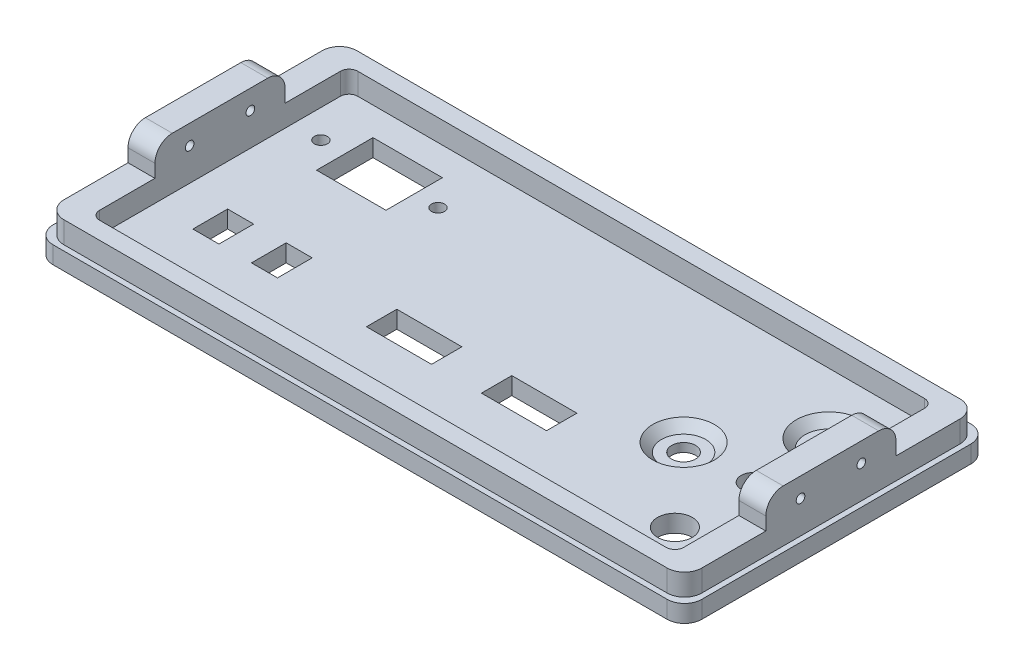
from build123d import *

# Parameters (mm, degrees)
SKETCH1_W           = 149.5
SKETCH1_H           = 70
BOSS_EXTRUDE1_DEPTH = 4
FILLET1_R           = 4
SKETCH6_W           = 147
SKETCH6_H           = 67.5
BOSS_EXTRUDE3_DEPTH = 5
FILLET2_R           = 4
SKETCH7_W           = 6.205469591
SKETCH7_H           = 30
BOSS_EXTRUDE4_DEPTH = 7
SKETCH8_R           = 1
CUT_EXTRUDE3_DEPTH  = 154.163515564
FILLET5_R           = 4
SKETCH9_W           = 134.589060818
SKETCH9_H           = 59.5
CUT_EXTRUDE4_DEPTH  = 5
FILLET7_R           = 2
SKETCH11_R          = 4
CUT_EXTRUDE5_DEPTH  = 84.406009975
SKETCH12_R          = 2.75
CUT_EXTRUDE6_DEPTH  = 84.406009975
SKETCH13_R          = 2.75
CUT_EXTRUDE7_DEPTH  = 84.406009975
SKETCH17_W          = 16
SKETCH17_H          = 13
CUT_EXTRUDE11_DEPTH = 84.406009975
SKETCH18_R          = 3
SKETCH18_W          = 15
SKETCH18_H          = 7
CUT_EXTRUDE12_DEPTH = 84.406009975
SKETCH19_W          = 6
SKETCH19_H          = 8
CUT_EXTRUDE13_DEPTH = 84.406009975
SKETCH20_R          = 1.5
CUT_EXTRUDE14_DEPTH = 84.406009975
SKETCH22_R          = 5.5
CUT_EXTRUDE15_DEPTH = 2
CHAMFER2_SIZE       = 2
SKETCH23_R          = 2.75
CUT_EXTRUDE16_DEPTH = 84.406009975
SKETCH24_R          = 5.1
CUT_EXTRUDE17_DEPTH = 2
CHAMFER3_SIZE       = 2


with BuildPart() as part:
    # Sketch1 → Boss-Extrude1 (new body)
    with BuildSketch(Plane(origin=(0, 0, 0), x_dir=(1, 0, 0), z_dir=(0, 1, 0))):
        Rectangle(SKETCH1_W, SKETCH1_H)
    extrude(amount=BOSS_EXTRUDE1_DEPTH)

    # Fillet1
    fillet1_edges = [part.edges().sort_by_distance(p)[0] for p in [
        (74.75, 2, 35),
        (-74.75, 2, 35),
        (-74.75, 2, -35),
        (74.75, 2, -35),
    ]]
    fillet(fillet1_edges, radius=FILLET1_R)

    # Sketch6 → Boss-Extrude3 (add)
    with BuildSketch(Plane(origin=(0, 4, 0), x_dir=(1, 0, 0), z_dir=(0, 1, 0))):
        Rectangle(SKETCH6_W, SKETCH6_H)
    extrude(amount=BOSS_EXTRUDE3_DEPTH)

    # Fillet2
    fillet2_edges = [part.edges().sort_by_distance(p)[0] for p in [
        (73.5, 6.5, 33.75),
        (73.5, 6.5, -33.75),
        (-73.5, 6.5, -33.75),
        (-73.5, 6.5, 33.75),
    ]]
    fillet(fillet2_edges, radius=FILLET2_R)

    # Sketch7 → Boss-Extrude4 (add)
    with BuildSketch(Plane(origin=(0, 9, 0), x_dir=(1, 0, 0), z_dir=(0, 1, 0))):
        with Locations((-70.397265205, 0)):
            Rectangle(SKETCH7_W, SKETCH7_H)
        with Locations((70.397265205, 0)):
            Rectangle(SKETCH7_W, SKETCH7_H)
    extrude(amount=BOSS_EXTRUDE4_DEPTH)

    # Sketch8 → Cut-Extrude3 (cut, through all)
    with BuildSketch(Plane.ZY.offset(73.5)):
        with Locations((-7, 11.5)):
            Circle(SKETCH8_R)
        with Locations((7, 11.5)):
            Circle(SKETCH8_R)
    extrude(amount=-CUT_EXTRUDE3_DEPTH, mode=Mode.SUBTRACT)

    # Fillet5
    fillet5_edges = [part.edges().sort_by_distance(p)[0] for p in [
        (-70.397265204, 16, 15),
        (-70.397265204, 16, -15),
        (70.397265204, 16, -15),
        (70.397265204, 16, 15),
    ]]
    fillet(fillet5_edges, radius=FILLET5_R)

    # Sketch9 → Cut-Extrude4 (cut)
    with BuildSketch(Plane(origin=(0, 9, 0), x_dir=(1, 0, 0), z_dir=(0, 1, 0))):
        Rectangle(SKETCH9_W, SKETCH9_H)
    extrude(amount=-CUT_EXTRUDE4_DEPTH, mode=Mode.SUBTRACT)

    # Fillet7
    fillet7_edges = [part.edges().sort_by_distance(p)[0] for p in [
        (67.294530409, 6.5, -29.75),
        (67.294530409, 6.5, 29.75),
        (-67.294530409, 6.5, 29.75),
        (-67.294530409, 6.5, -29.75),
    ]]
    fillet(fillet7_edges, radius=FILLET7_R)

    # Sketch11 → Cut-Extrude5 (cut, through all)
    with BuildSketch(Plane(origin=(0, 4, 0), x_dir=(1, 0, 0), z_dir=(0, 1, 0))):
        with Locations(Location((57.294530409, -19.75, 0), (0, 0, 270))):
            Circle(SKETCH11_R)
    extrude(amount=-CUT_EXTRUDE5_DEPTH, mode=Mode.SUBTRACT)

    # Sketch12 → Cut-Extrude6 (cut, through all)
    with BuildSketch(Plane(origin=(0, 4, 0), x_dir=(1, 0, 0), z_dir=(0, 1, 0))):
        with Locations(Location((57.294530409, -1.75, 0), (0, 0, 270))):
            Circle(SKETCH12_R)
    extrude(amount=-CUT_EXTRUDE6_DEPTH, mode=Mode.SUBTRACT)

    # Sketch13 → Cut-Extrude7 (cut, through all)
    with BuildSketch(Plane(origin=(0, 4, 0), x_dir=(1, 0, 0), z_dir=(0, 1, 0))):
        with Locations(Location((57.294530409, 15.75, 0), (0, 0, 270))):
            Circle(SKETCH13_R)
    extrude(amount=-CUT_EXTRUDE7_DEPTH, mode=Mode.SUBTRACT)

    # Sketch17 → Cut-Extrude11 (cut, through all)
    with BuildSketch(Plane(origin=(0, 4, 0), x_dir=(1, 0, 0), z_dir=(0, 1, 0))):
        with Locations((-47.294530409, 16.75)):
            Rectangle(SKETCH17_W, SKETCH17_H)
    extrude(amount=-CUT_EXTRUDE11_DEPTH, mode=Mode.SUBTRACT)

    # Sketch18 → Cut-Extrude12 (cut, through all)
    with BuildSketch(Plane(origin=(0, 4, 0), x_dir=(1, 0, 0), z_dir=(0, 1, 0))):
        with Locations(Location((-41.294530409, -11.75, 0), (0, 0, 270))):
            Circle(SKETCH18_R)
        with Locations(Location((-54.794530409, -11.75, 0), (0, 0, 270))):
            Circle(SKETCH18_R)
        with Locations((15.705469591, -11.75)):
            Rectangle(SKETCH18_W, SKETCH18_H)
        with Locations((-10.794530409, -11.75)):
            Rectangle(SKETCH18_W, SKETCH18_H)
    extrude(amount=-CUT_EXTRUDE12_DEPTH, mode=Mode.SUBTRACT)

    # Sketch19 → Cut-Extrude13 (cut, through all)
    with BuildSketch(Plane(origin=(0, 4, 0), x_dir=(1, 0, 0), z_dir=(0, 1, 0))):
        with Locations((-41.294530409, -11.75)):
            Rectangle(SKETCH19_W, SKETCH19_H)
        with Locations((-54.794530409, -11.75)):
            Rectangle(SKETCH19_W, SKETCH19_H)
    extrude(amount=-CUT_EXTRUDE13_DEPTH, mode=Mode.SUBTRACT)

    # Sketch20 → Cut-Extrude14 (cut, through all)
    with BuildSketch(Plane(origin=(0, 4, 0), x_dir=(1, 0, 0), z_dir=(0, 1, 0))):
        with Locations(Location((-60.794530409, 16.75, 0), (0, 0, 270))):
            Circle(SKETCH20_R)
        with Locations(Location((-33.794530409, 16.75, 0), (0, 0, 90))):
            Circle(SKETCH20_R)
    extrude(amount=-CUT_EXTRUDE14_DEPTH, mode=Mode.SUBTRACT)

    # Sketch22 → Cut-Extrude15 (cut)
    with BuildSketch(Plane(origin=(0, 4, 0), x_dir=(1, 0, 0), z_dir=(0, 1, 0))):
        with Locations(Location((57.294530409, 15.75, 0), (0, 0, 270))):
            Circle(SKETCH22_R)
    extrude(amount=-CUT_EXTRUDE15_DEPTH, mode=Mode.SUBTRACT)

    # Chamfer2
    chamfer2_edges = [part.edges().sort_by_distance(p)[0] for p in [
        (57.294530409, 4, -21.25),
    ]]
    chamfer(chamfer2_edges, length=CHAMFER2_SIZE - 0.0001)  # a hair under: the kernel refuses the full size

    # Sketch23 → Cut-Extrude16 (cut, through all)
    with BuildSketch(Plane(origin=(0, 4, 0), x_dir=(1, 0, 0), z_dir=(0, 1, 0))):
        with Locations(Location((41.294530409, -1.75, 0), (0, 0, 270))):
            Circle(SKETCH23_R)
    extrude(amount=-CUT_EXTRUDE16_DEPTH, mode=Mode.SUBTRACT)

    # Sketch24 → Cut-Extrude17 (cut)
    with BuildSketch(Plane(origin=(0, 4, 0), x_dir=(1, 0, 0), z_dir=(0, 1, 0))):
        with Locations(Location((41.294530409, -1.75, 0), (0, 0, 270))):
            Circle(SKETCH24_R)
    extrude(amount=-CUT_EXTRUDE17_DEPTH, mode=Mode.SUBTRACT)

    # Chamfer3
    chamfer3_edges = [part.edges().sort_by_distance(p)[0] for p in [
        (41.294530409, 4, -3.35),
    ]]
    chamfer(chamfer3_edges, length=CHAMFER3_SIZE - 0.0001)  # a hair under: the kernel refuses the full size


solid = part.part
